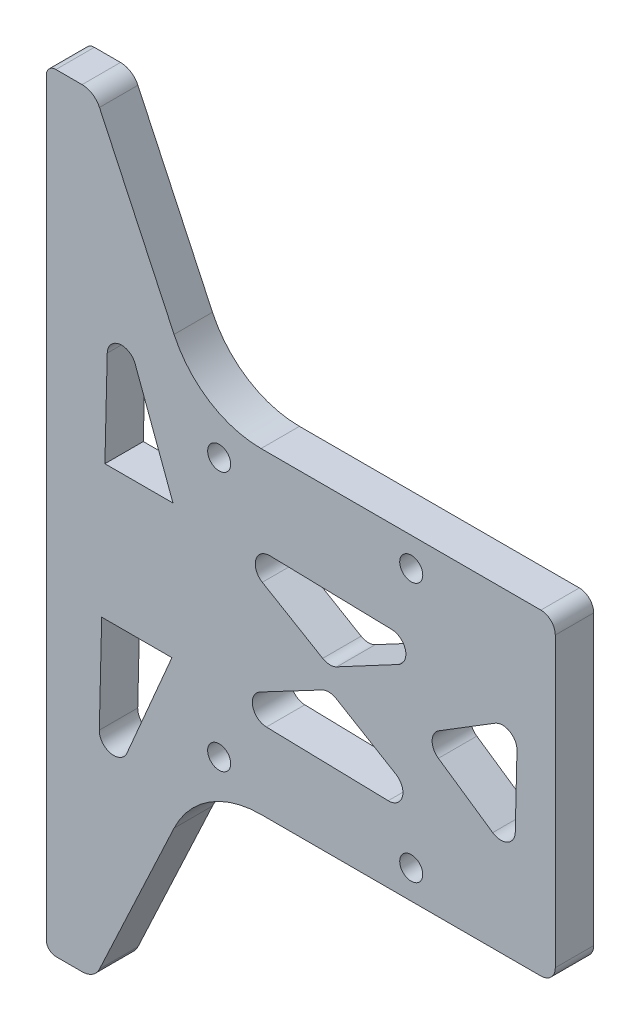
from build123d import *

# Parameters (mm, degrees)
EXTRUDE_1_DEPTH     = 11
CUT_EXTRUDE_START   = -7
CUT_EXTRUDE_1_DEPTH = 7
SKETCH_3_R          = 2.05
CUT_EXTRUDE_2_DEPTH = 37
FILLET_1_R          = 2
EXTRUDE_START       = -4
EXTRUDE_2_DEPTH     = 4
SKETCH_5_W          = 34.461524683
SKETCH_5_H          = 8.345685775
CUT_EXTRUDE_3_DEPTH = 34
SKETCH_6_R          = 1.2
CUT_EXTRUDE_4_DEPTH = 10


with BuildPart() as part:
    # 草图1 → 凸台-拉伸1 (new body)
    with BuildSketch(Plane.XY):
        with BuildLine():
            Line((3.72790966, 78.977626184), (1, 78.977626184))
            ThreePointArc((1, 78.977626184), (0.292893219, 78.684732965), (0, 77.977626184))
            Line((0, 77.977626184), (0, -0.022373816))
            ThreePointArc((0, -0.022373816), (0.292893219, -0.729480597), (1, -1.022373816))
            Line((1, -1.022373816), (3.72790966, -1.022373816))
            ThreePointArc((3.72790966, -1.022373816), (4.801278091, -0.709940174), (5.539290113, 0.129745972))
            Line((5.539290113, 0.129745972), (13.303549433, 16.717027245))
            ThreePointArc((13.303549433, 16.717027245), (16.993609545, 20.915457973), (22.360451698, 22.477626184))
            Line((22.360451698, 22.477626184), (51.5, 22.477626184))
            ThreePointArc((51.5, 22.477626184), (52.560660172, 22.916966012), (53, 23.977626184))
            Line((53, 23.977626184), (53, 53.977626184))
            ThreePointArc((53, 53.977626184), (52.560660172, 55.038286356), (51.5, 55.477626184))
            Line((51.5, 55.477626184), (22.360451698, 55.477626184))
            ThreePointArc((22.360451698, 55.477626184), (16.993609545, 57.039794395), (13.303549433, 61.238225124))
            Line((13.303549433, 61.238225124), (5.539290113, 77.825506396))
            ThreePointArc((5.539290113, 77.825506396), (4.801278091, 78.665192542), (3.72790966, 78.977626184))
        make_face()
        with BuildLine():
            Line((46.723063893, 42.88691809), (40.887588257, 39.289675292))
            ThreePointArc((40.887588257, 39.289675292), (40.373853978, 38.759625352), (40.175145399, 38.048716955))
            ThreePointArc((40.175145399, 38.048716955), (40.339583189, 37.329108685), (40.827345936, 36.77506595))
            Line((40.827345936, 36.77506595), (46.483868127, 32.90251016))
            ThreePointArc((46.483868127, 32.90251016), (48.014920506, 32.805104134), (48.830807058, 34.104310989))
            Line((48.830807058, 34.104310989), (49.009760503, 41.574109577))
            ThreePointArc((49.009760503, 41.574109577), (48.257024254, 42.91089582), (46.723063893, 42.88691809))
        make_face(mode=Mode.SUBTRACT)
        with BuildLine():
            Line((35.975157614, 45.967771208), (23.29289503, 46.27159929))
            ThreePointArc((23.29289503, 46.27159929), (22.222016888, 45.857788357), (21.757400208, 44.807954643))
            ThreePointArc((21.757400208, 44.807954643), (21.945365563, 44.044228792), (22.493939434, 43.480602267))
            Line((22.493939434, 43.480602267), (28.780793319, 39.766059947))
            ThreePointArc((28.780793319, 39.766059947), (29.511034587, 39.557845657), (30.249678725, 39.733943182))
            Line((30.249678725, 39.733943182), (36.645087423, 43.144657419))
            ThreePointArc((36.645087423, 43.144657419), (37.398702379, 44.814536207), (35.975157614, 45.967771208))
        make_face(mode=Mode.SUBTRACT)
        with BuildLine():
            Line((28.711627706, 36.878978358), (22.254110192, 33.469752057))
            ThreePointArc((22.254110192, 33.469752057), (21.679175619, 32.933041346), (21.454853835, 32.179192628))
            ThreePointArc((21.454853835, 32.179192628), (21.868664769, 31.108314486), (22.918498482, 30.643697806))
            Line((22.918498482, 30.643697806), (35.600761065, 30.339869724))
            ThreePointArc((35.600761065, 30.339869724), (37.077896972, 31.42361332), (36.405111016, 33.127664295))
            Line((36.405111016, 33.127664295), (30.180365947, 36.840718678))
            ThreePointArc((30.180365947, 36.840718678), (29.451001862, 37.051985174), (28.711627706, 36.878978358))
        make_face(mode=Mode.SUBTRACT)
        with BuildLine():
            Line((8.398953615, 21.036666397), (15.693636896, 38.077972893))
            ThreePointArc((15.693636896, 38.077972893), (15.814233328, 38.63232963), (15.720321381, 39.191825329))
            Line((15.720321381, 39.191825329), (9.25005307, 56.562897813))
            ThreePointArc((9.25005307, 56.562897813), (7.596092236, 57.518632984), (6.344825548, 56.075252289))
            Line((6.344825548, 56.075252289), (5.520410579, 21.66287331))
            ThreePointArc((5.520410579, 21.66287331), (6.701123529, 20.161229848), (8.398953615, 21.036666397))
        make_face(mode=Mode.SUBTRACT)
    extrude(amount=EXTRUDE_1_DEPTH)

    # 草图2 → 切除-拉伸1 (cut)
    with BuildSketch(Plane.XY.offset(11).offset(CUT_EXTRUDE_START)):
        with BuildLine():
            Line((23, 22.477626184), (23, 27.477626184))
            Line((23, 27.477626184), (53, 27.477626184))
            Line((53, 27.477626184), (53, 50.477626184))
            Line((53, 50.477626184), (23, 50.477626184))
            Line((23, 50.477626184), (23, 55.477626184))
            Line((23, 55.477626184), (22.360451698, 55.477626184))
            ThreePointArc((22.360451698, 55.477626184), (16.993609545, 57.039794395), (13.303549433, 61.238225124))
            Line((13.303549433, 61.238225124), (5.539290113, 77.825506396))
            ThreePointArc((5.539290113, 77.825506396), (4.801278091, 78.665192542), (3.72790966, 78.977626184))
            Line((3.72790966, 78.977626184), (1, 78.977626184))
            ThreePointArc((1, 78.977626184), (0.292893219, 78.684732965), (0, 77.977626184))
            Line((0, 77.977626184), (0, -0.022373816))
            ThreePointArc((0, -0.022373816), (0.292893219, -0.729480597), (1, -1.022373816))
            Line((1, -1.022373816), (3.72790966, -1.022373816))
            ThreePointArc((3.72790966, -1.022373816), (4.801278091, -0.709940174), (5.539290113, 0.129745972))
            Line((5.539290113, 0.129745972), (13.303549433, 16.717027245))
            ThreePointArc((13.303549433, 16.717027245), (16.993609545, 20.915457973), (22.360451698, 22.477626184))
            Line((22.360451698, 22.477626184), (23, 22.477626184))
        make_face()
    extrude(amount=CUT_EXTRUDE_1_DEPTH, mode=Mode.SUBTRACT)

    # 草图3 → 切除-拉伸2 (cut)
    with BuildSketch(Plane(origin=(0, 55.477626184, 0), x_dir=(1, 0, 0), z_dir=(0, 1, 0))):
        with Locations((48, -8)):
            Circle(SKETCH_3_R)
        with Locations((28, -8)):
            Circle(SKETCH_3_R)
    extrude(amount=-CUT_EXTRUDE_2_DEPTH, mode=Mode.SUBTRACT)

    # 圆角1
    fillet_1_edges = [part.edges().sort_by_distance(p)[0] for p in [
        (53, 27.477626184, 7.5),
        (23, 27.477626184, 7.5),
        (23, 22.477626184, 7.5),
        (23, 50.477626184, 7.5),
        (53, 50.477626184, 7.5),
        (23, 55.477626184, 7.5),
    ]]
    fillet(fillet_1_edges, radius=FILLET_1_R)

    # 草图4 → 凸台-拉伸2 (add)
    with BuildSketch(Plane.XY.offset(4).offset(EXTRUDE_START)):
        with BuildLine():
            Line((5.767520396, 31.977626184), (13.082329062, 31.977626184))
            Line((13.082329062, 31.977626184), (15.693636896, 38.077972893))
            ThreePointArc((15.693636896, 38.077972893), (15.814233328, 38.63232963), (15.720321381, 39.191825329))
            Line((15.720321381, 39.191825329), (13.192788767, 45.977626184))
            Line((13.192788767, 45.977626184), (6.102917422, 45.977626184))
            Line((6.102917422, 45.977626184), (5.767520396, 31.977626184))
        make_face()
    extrude(amount=EXTRUDE_2_DEPTH)

    # 草图5 → 切除-拉伸3 (cut)
    with BuildSketch(Plane(origin=(0, 55.477626184, 0), x_dir=(1, 0, 0), z_dir=(0, 1, 0))):
        with Locations((40.230762341, -8.172842887)):
            Rectangle(SKETCH_5_W, SKETCH_5_H)
    extrude(amount=-CUT_EXTRUDE_3_DEPTH, mode=Mode.SUBTRACT)

    # 草图6 → 切除-拉伸4 (cut)
    with BuildSketch(Plane.XY.offset(4)):
        with Locations((38, 52.477626184)):
            Circle(SKETCH_6_R)
        with Locations((18, 52.477626184)):
            Circle(SKETCH_6_R)
        with Locations((18, 25.477626184)):
            Circle(SKETCH_6_R)
        with Locations((38, 25.477626184)):
            Circle(SKETCH_6_R)
    extrude(amount=-CUT_EXTRUDE_4_DEPTH, mode=Mode.SUBTRACT)


solid = part.part
